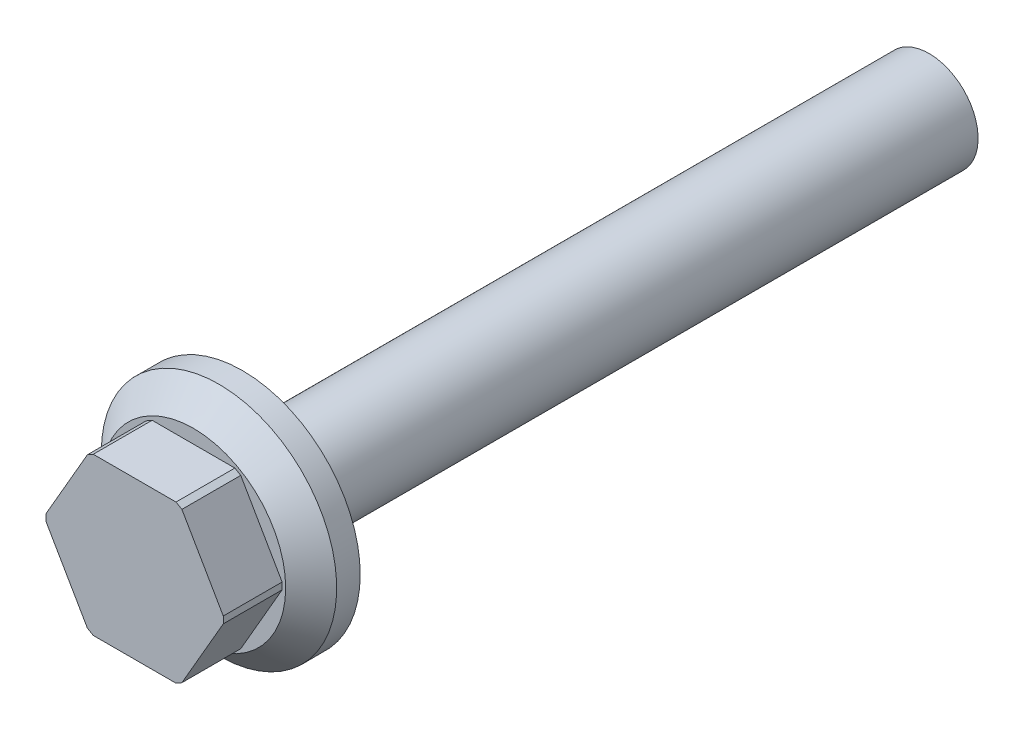
from build123d import *

# Parameters (mm, degrees)
SKETCH1_W                = 2.5
SKETCH1_H                = 35
SKETCH2_R                = 6
BOSS_EXTRUDE1_DEPTH      = 1
SKETCH3_R                = 4.4
BOSS_EXTRUDE2_DEPTH      = 1.5
CHAMFER1_SIZE            = 1.8
BOSS_EXTRUDE3_DEPTH      = 3
BOSS_EXTRUDE3_DEPTH_BACK = 1.5
CHAMFER2_SIZE            = 0.2
CHAMFER2_EDGE_2_SIZE     = 0.2
CHAMFER2_EDGE_3_SIZE     = 0.2
CHAMFER2_EDGE_4_SIZE     = 0.2
CHAMFER2_EDGE_5_SIZE     = 0.2
CHAMFER2_EDGE_6_SIZE     = 0.2


with BuildPart() as part:
    # Sketch1 → Revolve1 (revolve)
    with BuildSketch(Plane(origin=(0, 0, 0), x_dir=(1, 0, 0), z_dir=(0, 1, 0)), mode=Mode.PRIVATE) as revolve1_sk:
        with Locations((1.25, 17.5)):
            Rectangle(SKETCH1_W, SKETCH1_H)
    revolve(revolve1_sk.sketch.rotate(Axis((0, 0, -35), (0, 0, 1)), 180), axis=Axis((0, 0, -35), (0, 0, 1)))

    # Sketch2 → Boss-Extrude1 (add)
    with BuildSketch(Plane.XY):
        Circle(SKETCH2_R)
    extrude(amount=BOSS_EXTRUDE1_DEPTH)

    # Sketch3 → Boss-Extrude2 (add)
    with BuildSketch(Plane.XY.offset(1)):
        Circle(SKETCH3_R)
    extrude(amount=BOSS_EXTRUDE2_DEPTH)

    # Chamfer1
    # the kernel refuses this chamfer: 1.8 mm, written as the material it adds along each edge
    with BuildSketch(Plane(origin=(0, 0, 1), x_dir=(1, 0, 0), z_dir=(0, -1, 0))) as chamfer1_piece_1_section:
        Polygon((4.4 + CHAMFER1_SIZE, 0), (4.4, CHAMFER1_SIZE), (4.4, 0), align=None)
    chamfer1_piece_1 = revolve(axis=Axis((0, 0, 1), (0, 0, 1)), mode=Mode.PRIVATE)
    chamfer1_piece_1 = chamfer1_piece_1 & Plane(origin=(0, 0, 1.82351745), x_dir=(1, 0, 0), z_dir=(0, 0, -1)) * Cylinder(6, 25, mode=Mode.PRIVATE)
    chamfer1_piece_1 = split(chamfer1_piece_1, bisect_by=Plane(origin=(-5.32351745, 0, 2.5), z_dir=(0, 0, -1)), keep=Keep.TOP, mode=Mode.PRIVATE)
    add(chamfer1_piece_1)

    # Sketch4 → Boss-Extrude3 (add, two sides: drawn at the far end of the back side and taken through both)
    with BuildSketch(Plane.XY.offset(2.5).offset(-BOSS_EXTRUDE3_DEPTH_BACK)):
        Polygon((-2.309401077, 4), (-4.618802154, 0), (-2.309401077, -4), (2.309401077, -4), (4.618802154, 0), (2.309401077, 4), align=None)
    extrude(amount=BOSS_EXTRUDE3_DEPTH + BOSS_EXTRUDE3_DEPTH_BACK)

    # Chamfer2
    chamfer2_edges = [part.edges().sort_by_distance(p)[0] for p in [
        (-2.309401077, 4, 4),
    ]]
    chamfer(chamfer2_edges, length=CHAMFER2_SIZE)

    # Chamfer2 edge 2
    chamfer2_edge_2_edges = [part.edges().sort_by_distance(p)[0] for p in [
        (2.309401077, 4, 4),
    ]]
    chamfer(chamfer2_edge_2_edges, length=CHAMFER2_EDGE_2_SIZE)

    # Chamfer2 edge 3
    chamfer2_edge_3_edges = [part.edges().sort_by_distance(p)[0] for p in [
        (4.618802154, 0, 4),
    ]]
    chamfer(chamfer2_edge_3_edges, length=CHAMFER2_EDGE_3_SIZE)

    # Chamfer2 edge 4
    chamfer2_edge_4_edges = [part.edges().sort_by_distance(p)[0] for p in [
        (2.309401077, -4, 4),
    ]]
    chamfer(chamfer2_edge_4_edges, length=CHAMFER2_EDGE_4_SIZE)

    # Chamfer2 edge 5
    chamfer2_edge_5_edges = [part.edges().sort_by_distance(p)[0] for p in [
        (-2.309401077, -4, 4),
    ]]
    chamfer(chamfer2_edge_5_edges, length=CHAMFER2_EDGE_5_SIZE)

    # Chamfer2 edge 6
    chamfer2_edge_6_edges = [part.edges().sort_by_distance(p)[0] for p in [
        (-4.618802154, 0, 4),
    ]]
    chamfer(chamfer2_edge_6_edges, length=CHAMFER2_EDGE_6_SIZE)


solid = part.part
